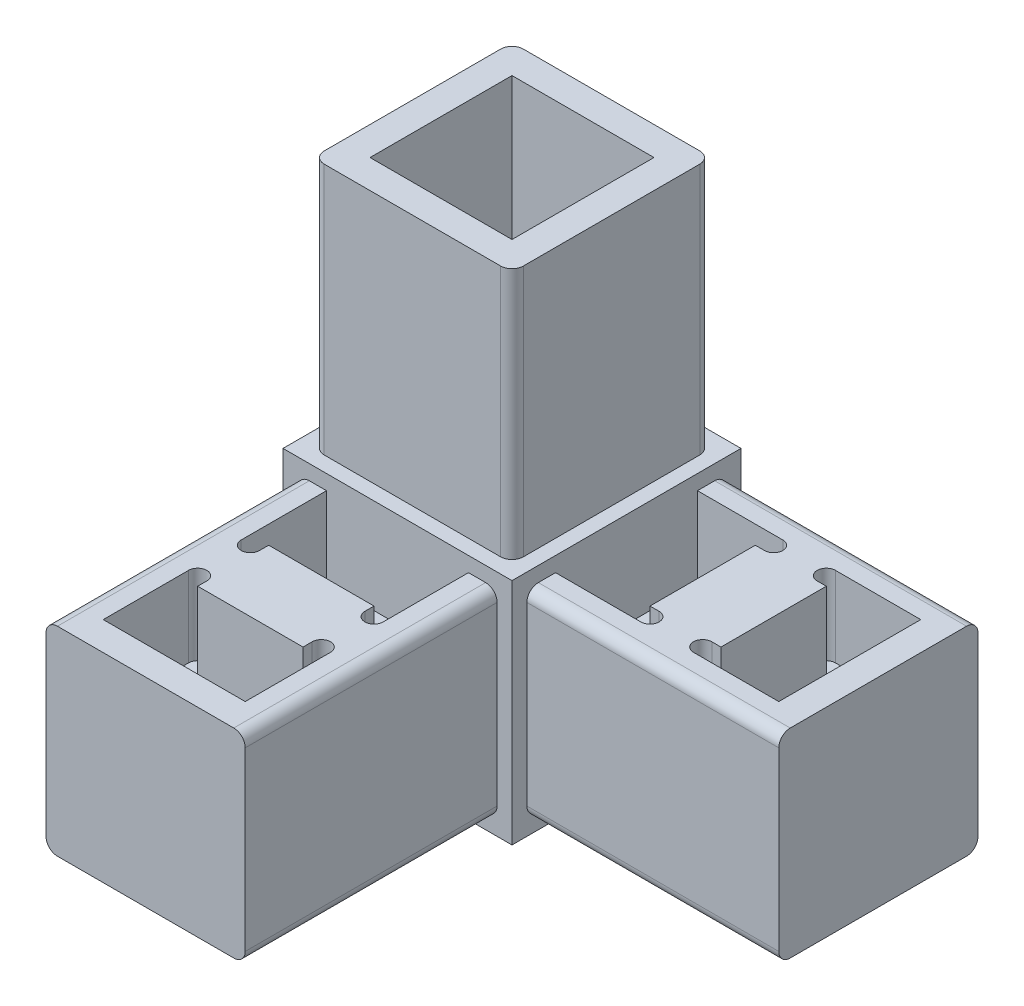
from build123d import *

# Parameters (mm, degrees)
BOSS_EXTRUDE1_START  = 2.159
BOSS_EXTRUDE1_DEPTH  = 8.89
BOSS_EXTRUDE2_DEPTH  = 2.032
BOSS_EXTRUDE3_DEPTH  = 4.318
BOSS_EXTRUDE4_START  = 8.89
BOSS_EXTRUDE4_DEPTH  = 8.89
SKETCH5_W            = 2.032
SKETCH5_H            = 8.89
CUT_EXTRUDE1_DEPTH   = 1.016
BOSS_EXTRUDE5_DEPTH  = 1.651
CUT_EXTRUDE2_DEPTH   = 8.4455
CUT_EXTRUDE3_DEPTH   = 8.4455
SKETCH9_W            = 2.032
SKETCH9_H            = 8.89
CUT_EXTRUDE4_DEPTH   = 1.016
SKETCH10_W           = 15.748
SKETCH10_H           = 8.89
CUT_EXTRUDE5_DEPTH   = 8.4455
BOSS_EXTRUDE6_DEPTH  = 3.175
SKETCH12_W           = 2.032
SKETCH12_H           = 8.89
CUT_EXTRUDE6_DEPTH   = 1.016
SKETCH13_W           = 15.748
SKETCH13_H           = 8.89
CUT_EXTRUDE7_DEPTH   = 8.4455
SKETCH14_W           = 27.94
SKETCH14_H           = 22.098
CUT_EXTRUDE8_DEPTH   = 27.94
BOSS_EXTRUDE7_DEPTH  = 3.175
SKETCH16_W           = 27.94
SKETCH16_H           = 22.098
CUT_EXTRUDE9_DEPTH   = 1.651
SKETCH17_W           = 27.94
SKETCH17_H           = 22.098
CUT_EXTRUDE10_DEPTH  = 1.651
SKETCH18_W           = 23.749
SKETCH18_H           = 23.749
BOSS_EXTRUDE8_DEPTH  = 1.651
SKETCH19_W           = 25.4
SKETCH19_H           = 23.749
BOSS_EXTRUDE9_DEPTH  = 1.651
SKETCH20_W           = 25.4
SKETCH20_H           = 25.4
BOSS_EXTRUDE10_DEPTH = 1.651
CUT_EXTRUDE11_DEPTH  = 8.89
CUT_EXTRUDE12_START  = -8.89
CUT_EXTRUDE12_DEPTH  = 8.89
CUT_EXTRUDE13_DEPTH  = 8.89
CUT_EXTRUDE14_START  = -8.89
CUT_EXTRUDE14_DEPTH  = 8.89
SKETCH25_W           = 22.098
SKETCH25_H           = 22.098
BOSS_EXTRUDE11_DEPTH = 27.94
SKETCH26_W           = 15.748
SKETCH26_H           = 15.748
CUT_EXTRUDE15_DEPTH  = 27.94
FILLET1_R            = 1.27


with BuildPart() as part:
    # Boss-Extrude1: read off the stored shape, not the designer's step
    # Boss-Extrude1 outline → Boss-Extrude1 (new body)
    with BuildSketch(Plane(origin=(0, 0, 0), x_dir=(1, 0, 0), z_dir=(0, 1, 0)).offset(BOSS_EXTRUDE1_START)):
        with BuildLine():
            Line((-5.842, -21.1455), (-5.842, -22.1615))
            ThreePointArc((-5.842, -22.1615), (-6.858, -23.1775), (-7.874, -22.1615))
            Line((-7.874, -22.1615), (-7.874, -40.64))
            Line((-7.874, -40.64), (40.64, -40.64))
            Line((40.64, -40.64), (40.64, 7.874))
            Line((40.64, 7.874), (22.1615, 7.874))
            ThreePointArc((22.1615, 7.874), (23.1775, 6.858), (22.1615, 5.842))
            Line((22.1615, 5.842), (-7.874, 5.842))
            Line((-7.874, 5.842), (-7.874, -21.1455))
            Line((-7.874, -21.1455), (-5.842, -21.1455))
        make_face()
        with BuildLine():
            Line((5.842, -22.1615), (7.874, -22.1615))
            ThreePointArc((7.874, -22.1615), (6.858, -23.1775), (5.842, -22.1615))
        make_face(mode=Mode.SUBTRACT)
        with BuildLine():
            Line((21.1455, -7.874), (21.1455, -5.842))
            Line((21.1455, -5.842), (22.1615, -5.842))
            ThreePointArc((22.1615, -5.842), (23.1775, -6.858), (22.1615, -7.874))
            Line((22.1615, -7.874), (21.1455, -7.874))
        make_face(mode=Mode.SUBTRACT)
    extrude(amount=BOSS_EXTRUDE1_DEPTH)

    # Sketch2 → Boss-Extrude2 (add)
    with BuildSketch(Plane(origin=(0, 0, -5.842), x_dir=(-1, 0, 0), z_dir=(0, 0, -1))):
        with BuildLine():
            Line((-21.1455, 2.159), (-21.1455, 11.049))
            Line((-21.1455, 11.049), (7.874, 11.049))
            Line((7.874, 11.049), (7.874, 2.159))
            Line((7.874, 2.159), (-12.7, 2.159))
            add(Edge.make_bspline(
                [(-21.1455, 2.159), (-18.330333333, 2.159), (-15.515166667, 2.159), (-12.7, 2.159)],
                knots=[0, 0, 0, 0, 1, 1, 1, 1], degree=3))
        make_face()
    extrude(amount=BOSS_EXTRUDE2_DEPTH)

    # Sketch3 → Boss-Extrude3 (add)
    with BuildSketch(Plane.XZ.offset(-2.159)):
        with BuildLine():
            Line((40.64, -7.874), (21.1455, -7.874))
            add(Edge.make_bspline(
                [(21.1455, -7.874), (18.330333333, -7.874), (15.515166667, -7.874), (12.7, -7.874)],
                knots=[0, 0, 0, 0, 1, 1, 1, 1], degree=3))
            Line((12.7, -7.874), (-7.874, -7.874))
            Line((-7.874, -7.874), (-7.874, 12.7))
            add(Edge.make_bspline(
                [(-7.874, 21.1455), (-7.874, 18.330333333), (-7.874, 15.515166667), (-7.874, 12.7)],
                knots=[0, 0, 0, 0, 1, 1, 1, 1], degree=3))
            Line((-7.874, 21.1455), (-7.874, 40.64))
            Line((-7.874, 40.64), (40.64, 40.64))
            Line((40.64, 40.64), (40.64, -7.874))
        make_face()
    extrude(amount=BOSS_EXTRUDE3_DEPTH)

    # Sketch4 → Boss-Extrude4 (add)
    with BuildSketch(Plane.XZ.offset(2.159).offset(BOSS_EXTRUDE4_START)):
        with BuildLine():
            Line((-7.874, -7.874), (-7.874, 12.7))
            add(Edge.make_bspline(
                [(-7.874, 21.1455), (-7.874, 18.330333333), (-7.874, 15.515166667), (-7.874, 12.7)],
                knots=[0, 0, 0, 0, 1, 1, 1, 1], degree=3))
            Line((-7.874, 21.1455), (-5.842, 21.1455))
            Line((-5.842, 21.1455), (-5.842, 22.1615))
            ThreePointArc((-5.842, 22.1615), (-6.858, 23.1775), (-7.874, 22.1615))
            Line((-7.874, 22.1615), (-7.874, 40.64))
            Line((-7.874, 40.64), (40.64, 40.64))
            Line((40.64, 40.64), (40.64, -7.874))
            Line((40.64, -7.874), (22.1615, -7.874))
            ThreePointArc((22.1615, -7.874), (23.1775, -6.858), (22.1615, -5.842))
            Line((22.1615, -5.842), (21.1455, -5.842))
            Line((21.1455, -5.842), (21.1455, -7.874))
            add(Edge.make_bspline(
                [(21.1455, -7.874), (18.330333333, -7.874), (15.515166667, -7.874), (12.7, -7.874)],
                knots=[0, 0, 0, 0, 1, 1, 1, 1], degree=3))
            Line((12.7, -7.874), (-7.874, -7.874))
        make_face()
        with BuildLine():
            Line((5.842, 22.1615), (7.874, 22.1615))
            ThreePointArc((7.874, 22.1615), (6.858, 23.1775), (5.842, 22.1615))
        make_face(mode=Mode.SUBTRACT)
        with BuildLine():
            Line((22.1615, 7.874), (22.1615, 5.842))
            ThreePointArc((22.1615, 5.842), (23.1775, 6.858), (22.1615, 7.874))
        make_face(mode=Mode.SUBTRACT)
    extrude(amount=-BOSS_EXTRUDE4_DEPTH)

    # Sketch5 → Cut-Extrude1 (cut)
    with BuildSketch(Plane.XY.offset(22.1615)):
        with Locations((6.858, 6.604)):
            Rectangle(SKETCH5_W, SKETCH5_H)
    extrude(amount=-CUT_EXTRUDE1_DEPTH, mode=Mode.SUBTRACT)

    # Sketch6 → Boss-Extrude5 (add)
    with BuildSketch(Plane(origin=(0, 11.049, 0), x_dir=(-1, 0, 0), z_dir=(0, 1, 0))):
        with BuildLine():
            Line((7.874, -7.874), (-12.7, -7.874))
            add(Edge.make_bspline(
                [(-21.1455, -7.874), (-18.330333333, -7.874), (-15.515166667, -7.874), (-12.7, -7.874)],
                knots=[0, 0, 0, 0, 1, 1, 1, 1], degree=3))
            Line((-21.1455, -7.874), (-21.1455, 12.7))
            add(Edge.make_bspline(
                [(-21.1455, 21.1455), (-21.1455, 18.330333333), (-21.1455, 15.515166667), (-21.1455, 12.7)],
                knots=[0, 0, 0, 0, 1, 1, 1, 1], degree=3))
            add(Edge.make_bspline(
                [(-21.1455, 21.1455), (-18.330333333, 21.1455), (-15.515166667, 21.1455), (-12.7, 21.1455)],
                knots=[0, 0, 0, 0, 1, 1, 1, 1], degree=3))
            Line((-12.7, 21.1455), (7.874, 21.1455))
            add(Edge.make_bspline(
                [(7.874, 21.1455), (7.874, 18.330333333), (7.874, 15.515166667), (7.874, 12.7)],
                knots=[0, 0, 0, 0, 1, 1, 1, 1], degree=3))
            Line((7.874, 12.7), (7.874, -7.874))
        make_face()
    extrude(amount=BOSS_EXTRUDE5_DEPTH)

    # Sketch7 → Cut-Extrude2 (cut)
    with BuildSketch(Plane.XY.offset(21.1455)):
        with BuildLine():
            Line((12.7, 12.7), (-7.874, 12.7))
            Line((-7.874, 12.7), (-7.874, 2.159))
            Line((-7.874, 2.159), (7.874, 2.159))
            Line((7.874, 2.159), (7.874, 11.049))
            Line((7.874, 11.049), (21.1455, 11.049))
            Line((21.1455, 11.049), (21.1455, 12.7))
            add(Edge.make_bspline(
                [(21.1455, 12.7), (18.330333333, 12.7), (15.515166667, 12.7), (12.7, 12.7)],
                knots=[0, 0, 0, 0, 1, 1, 1, 1], degree=3))
        make_face()
    extrude(amount=-CUT_EXTRUDE2_DEPTH, mode=Mode.SUBTRACT)

    # Sketch8 → Cut-Extrude3 (cut)
    with BuildSketch(Plane(origin=(21.1455, 0, 0), x_dir=(0, 0, -1), z_dir=(1, 0, 0))):
        Polygon((7.874, 2.159), (7.874, 12.7), (-12.7, 12.7), (-12.7, 11.049), (-7.874, 11.049), (-7.874, 2.159), align=None)
    extrude(amount=-CUT_EXTRUDE3_DEPTH, mode=Mode.SUBTRACT)

    # Sketch9 → Cut-Extrude4 (cut)
    with BuildSketch(Plane(origin=(22.1615, 0, 0), x_dir=(0, 0, -1), z_dir=(1, 0, 0))):
        with Locations((-6.858, -6.604)):
            Rectangle(SKETCH9_W, SKETCH9_H)
    extrude(amount=-CUT_EXTRUDE4_DEPTH, mode=Mode.SUBTRACT)

    # Sketch10 → Cut-Extrude5 (cut)
    with BuildSketch(Plane(origin=(21.1455, 0, 0), x_dir=(0, 0, -1), z_dir=(1, 0, 0))):
        with Locations((0, -6.604)):
            Rectangle(SKETCH10_W, SKETCH10_H)
    extrude(amount=-CUT_EXTRUDE5_DEPTH, mode=Mode.SUBTRACT)

    # Sketch11 → Boss-Extrude6 (add)
    with BuildSketch(Plane(origin=(0, 0, -7.874), x_dir=(-1, 0, 0), z_dir=(0, 0, -1))):
        Polygon((7.874, -11.049), (-40.64, -11.049), (-40.64, 11.049), (-12.7, 11.049), (-12.7, 12.7), (7.874, 12.7), align=None)
    extrude(amount=BOSS_EXTRUDE6_DEPTH)

    # Sketch12 → Cut-Extrude6 (cut)
    with BuildSketch(Plane.XY.offset(22.1615)):
        with Locations((6.858, -6.604)):
            Rectangle(SKETCH12_W, SKETCH12_H)
    extrude(amount=-CUT_EXTRUDE6_DEPTH, mode=Mode.SUBTRACT)

    # Sketch13 → Cut-Extrude7 (cut)
    with BuildSketch(Plane.XY.offset(21.1455)):
        with Locations((0, -6.604)):
            Rectangle(SKETCH13_W, SKETCH13_H)
    extrude(amount=-CUT_EXTRUDE7_DEPTH, mode=Mode.SUBTRACT)

    # Sketch14 → Cut-Extrude8 (cut)
    with BuildSketch(Plane.XY.offset(40.64)):
        with Locations((26.67, 0)):
            Rectangle(SKETCH14_W, SKETCH14_H)
    extrude(amount=-CUT_EXTRUDE8_DEPTH, mode=Mode.SUBTRACT)

    # Sketch15 → Boss-Extrude7 (add)
    with BuildSketch(Plane.ZY.offset(7.874)):
        Polygon((12.7, 11.049), (40.64, 11.049), (40.64, -11.049), (-11.049, -11.049), (-11.049, 12.7), (12.7, 12.7), align=None)
    extrude(amount=BOSS_EXTRUDE7_DEPTH)

    # Sketch16 → Cut-Extrude9 (cut)
    with BuildSketch(Plane.XY.offset(12.7)):
        with Locations((26.67, 0)):
            Rectangle(SKETCH16_W, SKETCH16_H)
    extrude(amount=-CUT_EXTRUDE9_DEPTH, mode=Mode.SUBTRACT)

    # Sketch17 → Cut-Extrude10 (cut)
    with BuildSketch(Plane(origin=(12.7, 0, 0), x_dir=(0, 0, -1), z_dir=(1, 0, 0))):
        with Locations((-26.67, 0)):
            Rectangle(SKETCH17_W, SKETCH17_H)
    extrude(amount=-CUT_EXTRUDE10_DEPTH, mode=Mode.SUBTRACT)

    # Sketch18 → Boss-Extrude8 (add)
    with BuildSketch(Plane.ZY.offset(11.049)):
        with Locations((0.8255, 0.8255)):
            Rectangle(SKETCH18_W, SKETCH18_H)
    extrude(amount=BOSS_EXTRUDE8_DEPTH)

    # Sketch19 → Boss-Extrude9 (add)
    with BuildSketch(Plane(origin=(0, 0, -11.049), x_dir=(-1, 0, 0), z_dir=(0, 0, -1))):
        with Locations((0, 0.8255)):
            Rectangle(SKETCH19_W, SKETCH19_H)
    extrude(amount=BOSS_EXTRUDE9_DEPTH)

    # Sketch20 → Boss-Extrude10 (add)
    with BuildSketch(Plane.XZ.offset(11.049)):
        Rectangle(SKETCH20_W, SKETCH20_H)
    extrude(amount=BOSS_EXTRUDE10_DEPTH)

    # Sketch21 → Cut-Extrude11 (cut)
    with BuildSketch(Plane.XZ.offset(11.049)):
        with BuildLine():
            Line((28.0035, 5.842), (29.0195, 5.842))
            Line((29.0195, 5.842), (29.0195, -5.842))
            Line((29.0195, -5.842), (28.0035, -5.842))
            ThreePointArc((28.0035, -5.842), (26.9875, -6.858), (28.0035, -7.874))
            Line((28.0035, -7.874), (37.465, -7.874))
            Line((37.465, -7.874), (37.465, 7.874))
            Line((37.465, 7.874), (28.0035, 7.874))
            ThreePointArc((28.0035, 7.874), (26.9875, 6.858), (28.0035, 5.842))
        make_face()
    extrude(amount=-CUT_EXTRUDE11_DEPTH, mode=Mode.SUBTRACT)

    # Sketch22 → Cut-Extrude12 (cut)
    with BuildSketch(Plane(origin=(0, 11.049, 0), x_dir=(-1, 0, 0), z_dir=(0, 1, 0)).offset(CUT_EXTRUDE12_START)):
        with BuildLine():
            Line((-29.0195, -5.842), (-29.0195, 5.842))
            Line((-29.0195, 5.842), (-28.0035, 5.842))
            ThreePointArc((-28.0035, 5.842), (-26.9875, 6.858), (-28.0035, 7.874))
            Line((-28.0035, 7.874), (-37.465, 7.874))
            Line((-37.465, 7.874), (-37.465, -7.874))
            Line((-37.465, -7.874), (-28.0035, -7.874))
            ThreePointArc((-28.0035, -7.874), (-26.9875, -6.858), (-28.0035, -5.842))
            Line((-28.0035, -5.842), (-29.0195, -5.842))
        make_face()
    extrude(amount=CUT_EXTRUDE12_DEPTH, mode=Mode.SUBTRACT)

    # Sketch23 → Cut-Extrude13 (cut)
    with BuildSketch(Plane.XZ.offset(11.049)):
        with BuildLine():
            Line((-7.874, 37.465), (-7.874, 28.0035))
            ThreePointArc((-7.874, 28.0035), (-6.858, 26.9875), (-5.842, 28.0035))
            Line((-5.842, 28.0035), (-5.842, 29.0195))
            Line((-5.842, 29.0195), (5.842, 29.0195))
            Line((5.842, 29.0195), (5.842, 28.0035))
            ThreePointArc((5.842, 28.0035), (6.858, 26.9875), (7.874, 28.0035))
            Line((7.874, 28.0035), (7.874, 37.465))
            Line((7.874, 37.465), (-7.874, 37.465))
        make_face()
    extrude(amount=-CUT_EXTRUDE13_DEPTH, mode=Mode.SUBTRACT)

    # Sketch24 → Cut-Extrude14 (cut)
    with BuildSketch(Plane(origin=(0, 11.049, 0), x_dir=(-1, 0, 0), z_dir=(0, 1, 0)).offset(CUT_EXTRUDE14_START)):
        with BuildLine():
            Line((5.842, 29.0195), (5.842, 28.0035))
            ThreePointArc((5.842, 28.0035), (6.858, 26.9875), (7.874, 28.0035))
            Line((7.874, 28.0035), (7.874, 37.465))
            Line((7.874, 37.465), (-7.874, 37.465))
            Line((-7.874, 37.465), (-7.874, 28.0035))
            ThreePointArc((-7.874, 28.0035), (-6.858, 26.9875), (-5.842, 28.0035))
            Line((-5.842, 28.0035), (-5.842, 29.0195))
            Line((-5.842, 29.0195), (5.842, 29.0195))
        make_face()
    extrude(amount=CUT_EXTRUDE14_DEPTH, mode=Mode.SUBTRACT)

    # Sketch25 → Boss-Extrude11 (add)
    with BuildSketch(Plane(origin=(0, 12.7, 0), x_dir=(-1, 0, 0), z_dir=(0, 1, 0))):
        Rectangle(SKETCH25_W, SKETCH25_H)
    extrude(amount=BOSS_EXTRUDE11_DEPTH)

    # Sketch26 → Cut-Extrude15 (cut)
    with BuildSketch(Plane(origin=(0, 40.64, 0), x_dir=(-1, 0, 0), z_dir=(0, 1, 0))):
        Rectangle(SKETCH26_W, SKETCH26_H)
    extrude(amount=-CUT_EXTRUDE15_DEPTH, mode=Mode.SUBTRACT)

    # Fillet1
    fillet1_edges = [part.edges().sort_by_distance(p)[0] for p in [
        (26.67, 11.049, -11.049),
        (26.67, -11.049, -11.049),
        (-11.049, 11.049, 26.67),
        (26.67, 11.049, 11.049),
        (26.67, -11.049, 11.049),
        (11.049, -11.049, 26.67),
        (11.049, 11.049, 26.67),
        (-11.049, -11.049, 26.67),
        (-11.049, 26.67, -11.049),
        (-11.049, 26.67, 11.049),
        (11.049, 26.67, 11.049),
        (11.049, 26.67, -11.049),
    ]]
    fillet(fillet1_edges, radius=FILLET1_R)


solid = part.part
